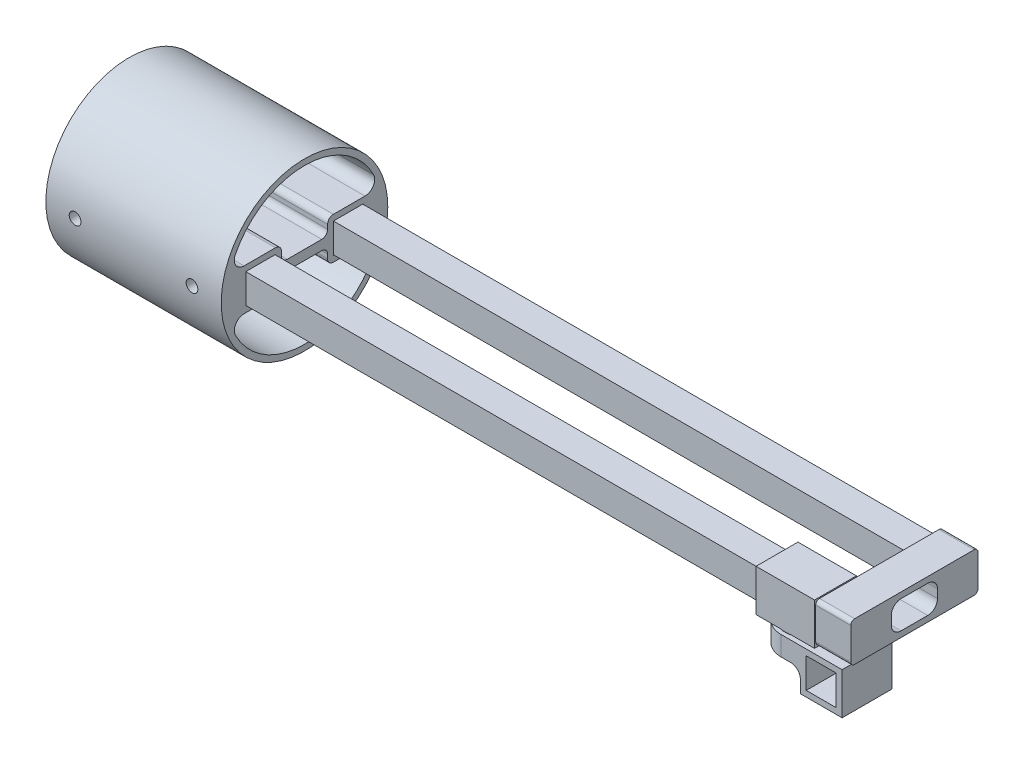
from build123d import *

# Parameters (mm, degrees)
SKETCH1_R                = 42.75
SKETCH1_W                = 15.3
SKETCH1_H                = 15.3
BOSS_EXTRUDE1_DEPTH      = 90
CUT_EXTRUDE2_START       = 30
SKETCH2_R                = 1.525
CUT_EXTRUDE2_DEPTH       = 79.421054228
CUT_EXTRUDE3_START       = 37
SKETCH2_3_R              = 3
SKETCH2_3_R_2            = 1.525
CUT_EXTRUDE3_DEPTH       = 72.42105439
CUT_EXTRUDE4_DEPTH       = 109.42105439
FILLET1_R                = 3
SKETCH1_3_W              = 15
SKETCH1_3_H              = 15
BOSS_EXTRUDE2_DEPTH      = 400
BOSS_EXTRUDE2_2_DEPTH    = 400
SKETCH4_W                = 65.3
SKETCH4_H                = 20.3
BOSS_EXTRUDE3_DEPTH      = 3
SKETCH4_3_W              = 65.3
SKETCH4_3_H              = 20.3
SKETCH4_3_W_2            = 15.3
SKETCH4_3_H_2            = 15.3
BOSS_EXTRUDE4_DEPTH      = 15
SKETCH5_W                = 23.7
SKETCH5_H                = 14.3
CUT_EXTRUDE5_DEPTH       = 408.509662582
FILLET2_R                = 5
FILLET3_R                = 2
BOSS_EXTRUDE5_START      = -15
SKETCH6_W                = 21.5
SKETCH6_H                = 21.5
SKETCH6_W_2              = 15.5
SKETCH6_H_2              = 15.5
BOSS_EXTRUDE5_DEPTH      = 30
SKETCH9_W                = 1.65
SKETCH9_H                = 3
SKETCH9_4_W              = 9
SKETCH9_4_H              = 5
FILLET4_R                = 5
BOSS_EXTRUDE6_START      = 0.3
BOSS_EXTRUDE6_DEPTH      = 3
BOSS_EXTRUDE8_START      = 3.3
BOSS_EXTRUDE8_OUTLINE_W  = 3
BOSS_EXTRUDE8_OUTLINE_H  = 25.7
BOSS_EXTRUDE8_DEPTH      = 15.4
BOSS_EXTRUDE9_START      = 3.3
BOSS_EXTRUDE9_DEPTH      = 7
BOSS_EXTRUDE10_START     = 18.7
BOSS_EXTRUDE10_OUTLINE_W = 21.4
BOSS_EXTRUDE10_OUTLINE_H = 25.7
BOSS_EXTRUDE10_DEPTH     = 3
FILLET5_R                = 5
SKETCH12_R               = 1.65
CUT_EXTRUDE6_DEPTH       = 3
CUT_EXTRUDE7_DEPTH       = 1.7


# Read off the part's stored shape, not the designer's step: Boss-Extrude8, Boss-Extrude10
with BuildPart() as part:
    # Sketch1 → Boss-Extrude1 (new body)
    with BuildSketch(Plane(origin=(0, 0, 0), x_dir=(0, 0, -1), z_dir=(1, 0, 0))):
        with Locations(Location((0, 0, 0), (0, 0, 180))):
            Circle(SKETCH1_R)
        with Locations((22.5, 0)):
            Rectangle(SKETCH1_W, SKETCH1_H, mode=Mode.SUBTRACT)
        with Locations((-22.5, 0)):
            Rectangle(SKETCH1_W, SKETCH1_H, mode=Mode.SUBTRACT)
    extrude(amount=BOSS_EXTRUDE1_DEPTH)

    # Sketch2 → Cut-Extrude2 (cut, through all)
    with BuildSketch(Plane.XY.offset(CUT_EXTRUDE2_START)):
        with Locations(Location((15, 0, 0), (0, 0, 180))):
            Circle(SKETCH2_R)
        with Locations(Location((75, 0, 0), (0, 0, 180))):
            Circle(SKETCH2_R)
    cut_extrude2 = extrude(amount=CUT_EXTRUDE2_DEPTH, mode=Mode.SUBTRACT)

    # Sketch2<3> → Cut-Extrude3 (cut, through all)
    # profile 1 of 2: a face of its own
    with BuildSketch(Plane.XY.offset(CUT_EXTRUDE3_START)):
        with Locations(Location((15, 0, 0), (0, 0, 180))):
            Circle(SKETCH2_3_R)
        with Locations(Location((15, 0, 0), (0, 0, 90))):
            Circle(SKETCH2_3_R_2, mode=Mode.SUBTRACT)
    # profile 2 of 2: a face of its own
    with BuildSketch(Plane.XY.offset(CUT_EXTRUDE3_START)):
        with Locations(Location((75, 0, 0), (0, 0, 180))):
            Circle(SKETCH2_3_R)
        with Locations(Location((75, 0, 0), (0, 0, 90))):
            Circle(SKETCH2_3_R_2, mode=Mode.SUBTRACT)
    cut_extrude3 = extrude(amount=CUT_EXTRUDE3_DEPTH, mode=Mode.SUBTRACT)

    # Mirror1: Cut-Extrude2, Cut-Extrude3 across plane
    add(cut_extrude2.mirror(Plane.XY), mode=Mode.SUBTRACT)
    add(cut_extrude3.mirror(Plane.XY), mode=Mode.SUBTRACT)

    # Sketch3 → Cut-Extrude4 (cut, through all)
    with BuildSketch(Plane(origin=(90, 0, 0), x_dir=(0, 0, -1), z_dir=(1, 0, 0))):
        with BuildLine():
            Line((-38.296736153, 10.65), (-33.15, 10.65))
            Line((-33.15, 10.65), (-11.85, 10.65))
            Line((-11.85, 10.65), (-11.85, 2.5))
            Line((-11.85, 2.5), (11.85, 2.5))
            Line((11.85, 2.5), (11.85, 10.65))
            Line((11.85, 10.65), (33.15, 10.65))
            Line((33.15, 10.65), (38.296736153, 10.65))
            ThreePointArc((38.296736153, 10.65), (0, 39.75), (-38.296736153, 10.65))
        make_face()
        with BuildLine():
            Line((-11.85, -10.65), (-33.15, -10.65))
            Line((-33.15, -10.65), (-38.296736153, -10.65))
            ThreePointArc((-38.296736153, -10.65), (0, -39.75), (38.296736153, -10.65))
            Line((38.296736153, -10.65), (33.15, -10.65))
            Line((33.15, -10.65), (11.85, -10.65))
            Line((11.85, -10.65), (11.85, -2.5))
            Line((11.85, -2.5), (-11.85, -2.5))
            Line((-11.85, -2.5), (-11.85, -10.65))
        make_face()
    extrude(amount=-CUT_EXTRUDE4_DEPTH, mode=Mode.SUBTRACT)

    # Fillet1
    fillet1_edges = [part.edges().sort_by_distance(p)[0] for p in [
        (45, 10.65, -11.85),
        (45, 2.5, -11.85),
        (45, 2.5, 11.85),
        (45, 10.65, 11.85),
        (45, -10.65, 11.85),
        (45, -2.5, 11.85),
        (45, -2.5, -11.85),
        (45, -10.65, -11.85),
    ]]
    fillet(fillet1_edges, radius=FILLET1_R)

    # Fillet4
    fillet4_edges = [part.edges().sort_by_distance(p)[0] for p in [
        (45, 10.65, -38.296736153),
        (45, 10.65, 38.296736153),
        (45, -10.65, 38.296736153),
        (45, -10.65, -38.296736153),
    ]]
    fillet(fillet4_edges, radius=FILLET4_R)


with BuildPart() as body_2:
    # Sketch1<3> → Boss-Extrude2 (new body)
    with BuildSketch(Plane(origin=(0, 0, 0), x_dir=(0, 0, -1), z_dir=(1, 0, 0))):
        with Locations((-22.5, 0)):
            Rectangle(SKETCH1_3_W, SKETCH1_3_H)
    extrude(amount=BOSS_EXTRUDE2_DEPTH)


with BuildPart() as body_3:
    # Sketch1<3> → Boss-Extrude2 2 (new body)
    with BuildSketch(Plane(origin=(0, 0, 0), x_dir=(0, 0, -1), z_dir=(1, 0, 0))):
        with Locations((22.5, 0)):
            Rectangle(SKETCH1_3_W, SKETCH1_3_H)
    extrude(amount=BOSS_EXTRUDE2_2_DEPTH)


with BuildPart() as body_4:
    # Sketch4 → Boss-Extrude3 (new body)
    with BuildSketch(Plane(origin=(400, 0, 0), x_dir=(0, 0, -1), z_dir=(1, 0, 0))):
        Rectangle(SKETCH4_W, SKETCH4_H)
    extrude(amount=BOSS_EXTRUDE3_DEPTH)

    # Sketch4<3> → Boss-Extrude4 (add)
    with BuildSketch(Plane(origin=(400, 0, 0), x_dir=(0, 0, -1), z_dir=(1, 0, 0))):
        Rectangle(SKETCH4_3_W, SKETCH4_3_H)
        with Locations((-22.5, 0)):
            Rectangle(SKETCH4_3_W_2, SKETCH4_3_H_2, mode=Mode.SUBTRACT)
        with Locations((22.5, 0)):
            Rectangle(SKETCH4_3_W_2, SKETCH4_3_H_2, mode=Mode.SUBTRACT)
    extrude(amount=-BOSS_EXTRUDE4_DEPTH)

    # Sketch5 → Cut-Extrude5 (cut, through all)
    with BuildSketch(Plane(origin=(403, 0, 0), x_dir=(0, 0, -1), z_dir=(1, 0, 0))):
        Rectangle(SKETCH5_W, SKETCH5_H)
    extrude(amount=-CUT_EXTRUDE5_DEPTH, mode=Mode.SUBTRACT)

    # Fillet2
    fillet2_edges = [body_4.edges().sort_by_distance(p)[0] for p in [
        (394, 7.15, -11.85),
        (394, -7.15, -11.85),
        (394, -7.15, 11.85),
        (394, 7.15, 11.85),
    ]]
    fillet(fillet2_edges, radius=FILLET2_R)

    # Fillet3
    fillet3_edges = [body_4.edges().sort_by_distance(p)[0] for p in [
        (394, 10.15, 32.65),
        (394, -10.15, 32.65),
        (394, -10.15, -32.65),
        (394, 10.15, -32.65),
    ]]
    fillet(fillet3_edges, radius=FILLET3_R)


with BuildPart() as body_5:
    # Sketch6 → Boss-Extrude5 (new body)
    with BuildSketch(Plane(origin=(400, 0, 0), x_dir=(0, 0, -1), z_dir=(1, 0, 0)).offset(BOSS_EXTRUDE5_START)):
        with Locations((-22.5, 0)):
            Rectangle(SKETCH6_W, SKETCH6_H)
        with Locations((-22.5, 0)):
            Rectangle(SKETCH6_W_2, SKETCH6_H_2, mode=Mode.SUBTRACT)
    extrude(amount=-BOSS_EXTRUDE5_DEPTH)

    # Sketch9 → Cut-Revolve1 (revolve, cut)
    with BuildSketch(Plane(origin=(370, 0, 0), x_dir=(0, 0, -1), z_dir=(1, 0, 0))):
        with Locations((-23.325, -9.25)):
            Rectangle(SKETCH9_W, SKETCH9_H)
    revolve(axis=Axis((370, -10.75, 22.5), (0, -1, 0)), mode=Mode.SUBTRACT)

    # Sketch9<4> → Revolve1 (revolve)
    with BuildSketch(Plane(origin=(370, 0, 0), x_dir=(0, 0, -1), z_dir=(1, 0, 0))):
        with Locations((-28.65, -13.25)):
            Rectangle(SKETCH9_4_W, SKETCH9_4_H)
    revolve(axis=Axis((370, -10.75, 22.5), (0, -1, 0)))


with BuildPart() as body_6:
    # Sketch9<5> → Revolve2 (revolve)
    with BuildSketch(Plane(origin=(370, 0, 0), x_dir=(0, 0, -1), z_dir=(1, 0, 0))):
        Polygon((-24.15, -21.05), (-24.15, -15.75), (-33.15, -15.75), (-33.35, -15.75), (-33.35, -11.05), (-35.35, -11.05), (-35.35, -21.05), align=None)
    revolve(axis=Axis((370, -10.75, 22.5), (0, -1, 0)))

    # Sketch11 → Boss-Extrude6 (add)
    with BuildSketch(Plane.XZ.offset(10.75).offset(BOSS_EXTRUDE6_START)):
        with BuildLine():
            Line((401.25, 9.65), (401.25, 35.35))
            Line((401.25, 35.35), (370, 35.35))
            ThreePointArc((370, 35.35), (382.85, 22.5), (370, 9.65))
            Line((370, 9.65), (401.25, 9.65))
        make_face()
    extrude(amount=BOSS_EXTRUDE6_DEPTH)

    # Boss-Extrude8 outline → Boss-Extrude8 (add)
    with BuildSketch(Plane.XZ.offset(10.75).offset(BOSS_EXTRUDE8_START)):
        with Locations((399.75, 22.5)):
            Rectangle(BOSS_EXTRUDE8_OUTLINE_W, BOSS_EXTRUDE8_OUTLINE_H)
        with Locations((381.35, 22.5)):
            Rectangle(BOSS_EXTRUDE8_OUTLINE_W, BOSS_EXTRUDE8_OUTLINE_H)
    extrude(amount=BOSS_EXTRUDE8_DEPTH)

    # Sketch11<5> → Boss-Extrude9 (add)
    with BuildSketch(Plane.XZ.offset(10.75).offset(BOSS_EXTRUDE9_START)):
        with BuildLine():
            Line((379.85, 33.25), (379.85, 35.35))
            Line((379.85, 35.35), (370, 35.35))
            ThreePointArc((370, 35.35), (373.673213852, 34.813813382), (377.039886363, 33.25))
            Line((377.039886363, 33.25), (379.85, 33.25))
        make_face()
        with BuildLine():
            Line((370, 9.65), (379.85, 9.65))
            Line((379.85, 9.65), (379.85, 11.75))
            Line((379.85, 11.75), (377.039886363, 11.75))
            ThreePointArc((377.039886363, 11.75), (373.673213852, 10.186186618), (370, 9.65))
        make_face()
        with BuildLine():
            Line((379.85, 11.75), (379.85, 14.247727586))
            ThreePointArc((379.85, 14.247727586), (378.536786638, 12.895533649), (377.039886363, 11.75))
            Line((377.039886363, 11.75), (379.85, 11.75))
        make_face()
        with BuildLine():
            Line((379.85, 30.752272414), (379.85, 33.25))
            Line((379.85, 33.25), (377.039886363, 33.25))
            ThreePointArc((377.039886363, 33.25), (378.536786638, 32.104466351), (379.85, 30.752272414))
        make_face()
    extrude(amount=BOSS_EXTRUDE9_DEPTH)

    # Boss-Extrude10 outline → Boss-Extrude10 (add)
    with BuildSketch(Plane.XZ.offset(10.75).offset(BOSS_EXTRUDE10_START)):
        with Locations((390.55, 22.5)):
            Rectangle(BOSS_EXTRUDE10_OUTLINE_W, BOSS_EXTRUDE10_OUTLINE_H)
    extrude(amount=BOSS_EXTRUDE10_DEPTH)

    # Fillet5
    fillet5_edges = [body_6.edges().sort_by_distance(p)[0] for p in [
        (379.85, -21.05, 22.5),
    ]]
    fillet(fillet5_edges, radius=FILLET5_R)

    # Sketch12 → Cut-Extrude6 (cut)
    with BuildSketch(Plane.XZ.offset(32.45)):
        with Locations(Location((390.55, 22.5, 0), (0, 0, 270))):
            Circle(SKETCH12_R)
    extrude(amount=-CUT_EXTRUDE6_DEPTH, mode=Mode.SUBTRACT)

    # Sketch13 → Cut-Extrude7 (cut)
    with BuildSketch(Plane(origin=(0, -14.05, 0), x_dir=(1, 0, 0), z_dir=(0, 1, 0))):
        with BuildLine():
            Line((379.85, -17.950274734), (379.85, -27.049725266))
            ThreePointArc((379.85, -27.049725266), (380.85, -22.5), (379.85, -17.950274734))
        make_face()
    extrude(amount=-CUT_EXTRUDE7_DEPTH, mode=Mode.SUBTRACT)


solid = Compound([part.part, body_2.part, body_3.part, body_4.part, body_5.part, body_6.part])
